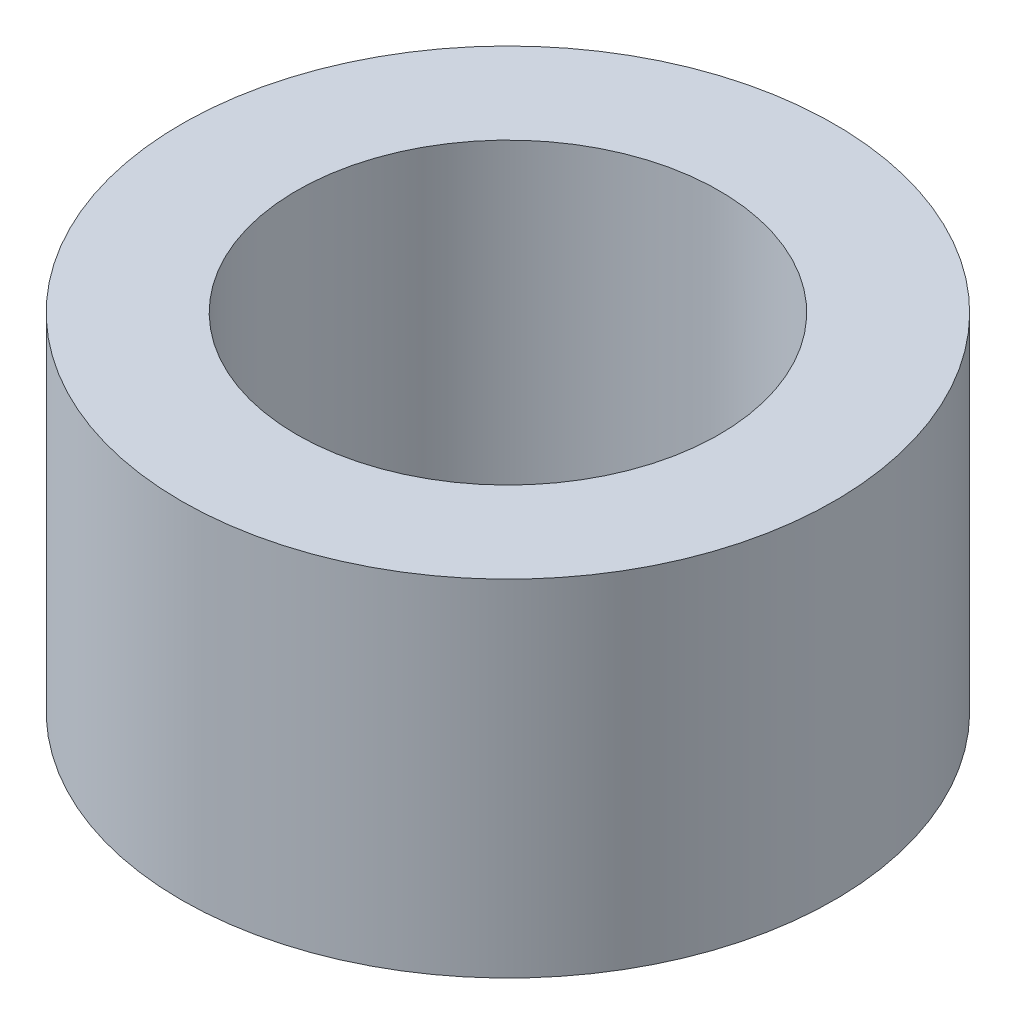
from build123d import *

# Parameters (mm, degrees)
SKETCH1_R           = 15
BOSS_EXTRUDE1_DEPTH = 15.869961969
SKETCH2_R           = 9.705747657
CUT_EXTRUDE1_DEPTH  = 27.492559199


with BuildPart() as part:
    # Sketch1 → Boss-Extrude1 (new body)
    with BuildSketch(Plane(origin=(0, 0, 0), x_dir=(1, 0, 0), z_dir=(0, 1, 0))):
        Circle(SKETCH1_R)
    extrude(amount=BOSS_EXTRUDE1_DEPTH)

    # Sketch2 → Cut-Extrude1 (cut, through all)
    with BuildSketch(Plane(origin=(0, 0, 0), x_dir=(1, 0, 0), z_dir=(0, 1, 0))):
        Circle(SKETCH2_R)
    extrude(amount=CUT_EXTRUDE1_DEPTH, mode=Mode.SUBTRACT)


solid = part.part
